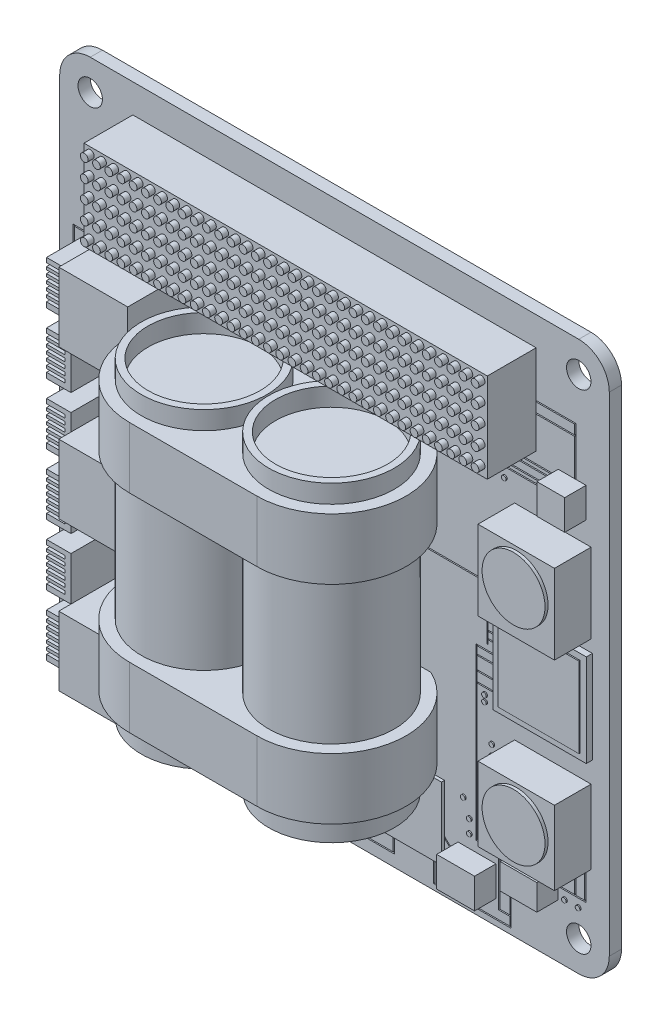
from build123d import *
from OCP.BRepFilletAPI import BRepFilletAPI_MakeChamfer

# Parameters (mm, degrees)
SKETCH1_W                     = 90
SKETCH1_H                     = 90
BOSS_EXTRUDE1_DEPTH           = 2
FILLET1_R                     = 5
SKETCH2_R                     = 2
CUT_EXTRUDE1_DEPTH            = 2
SKETCH3_W                     = 66.045919966
SKETCH3_H                     = 14.648074504
BOSS_EXTRUDE2_DEPTH           = 8
SKETCH4_R                     = 0.63201174
BOSS_EXTRUDE3_DEPTH           = 1
BOSS_EXTRUDE4_START           = 3
SKETCH5_R                     = 10.297013514
BOSS_EXTRUDE4_DEPTH           = 51
BOSS_EXTRUDE4_2_DEPTH         = 51
SKETCH6_R                     = 9.178141341
CUT_EXTRUDE2_DEPTH            = 3
SKETCH7_R                     = 9.178141341
CUT_EXTRUDE3_DEPTH            = 3
BOSS_EXTRUDE5_START           = -1
BOSS_EXTRUDE5_DEPTH           = 10
LPATTERN1_COUNT               = 2
LPATTERN1_PITCH               = 34
SKETCH9_W                     = 11.294906271
SKETCH9_H                     = 11.294906271
SKETCH9_H_2                   = 11.29490627
BOSS_EXTRUDE6_DEPTH           = 10
SKETCH10_W                    = 4.004248946
SKETCH10_H                    = 7.175245947
BOSS_EXTRUDE7_DEPTH           = 8
SKETCH11_W                    = 2.034326561
SKETCH11_H                    = 0.53377272
CUT_EXTRUDE4_DEPTH            = 3
LPATTERN2_COUNT               = 6
LPATTERN2_PITCH               = 10
SKETCH12_W                    = 12.521625327
SKETCH12_H                    = 12.116411975
SKETCH12_H_2                  = 13.021482362
BOSS_EXTRUDE8_DEPTH           = 6
SKETCH13_R                    = 5.151930766
BOSS_EXTRUDE9_DEPTH           = 0.5
SKETCH14_W                    = 15.282265806
SKETCH14_H                    = 15.130956244
BOSS_EXTRUDE10_DEPTH          = 1
SKETCH15_W                    = 14.979646681
SKETCH15_H                    = 11.80214587
BOSS_EXTRUDE11_DEPTH          = 0.5
SKETCH16_R                    = 6.652439648
BOSS_EXTRUDE12_DEPTH          = 0.5
SKETCH17_W                    = 9.485581338
SKETCH17_H                    = 1.963853578
SKETCH17_W_2                  = 7.713549659
BOSS_EXTRUDE13_DEPTH          = 10.5
CHAMFER1_SIZE                 = 10
CHAMFER1_SIZE2                = 1.227845609
SKETCH18_W                    = 4.557516941
SKETCH18_H                    = 4.922118296
SKETCH18_W_2                  = 6.015922362
SKETCH18_H_2                  = 4.192915586
SKETCH18_W_3                  = 6.198223039
SKETCH18_H_3                  = 4.010614908
SKETCH18_H_4                  = 3.646013552
BOSS_EXTRUDE14_DEPTH          = 3.5
CUT_EXTRUDE_THIN3_START       = -0.2
CUT_EXTRUDE_THIN3_OUTLINE_W   = 0.2
CUT_EXTRUDE_THIN3_OUTLINE_H   = 67.261210644
CUT_EXTRUDE_THIN3_OUTLINE_W_2 = 9.692781781
CUT_EXTRUDE_THIN3_OUTLINE_H_2 = 0.2
CUT_EXTRUDE_THIN3_OUTLINE_W_3 = 8.725884702
CUT_EXTRUDE_THIN3_OUTLINE_W_4 = 7.231547932
CUT_EXTRUDE_THIN3_OUTLINE_H_3 = 3.995497833
CUT_EXTRUDE_THIN3_DEPTH       = 0.2
SKETCH20_R                    = 0.38040715
BOSS_EXTRUDE15_DEPTH          = 0.2
SKETCH21_W                    = 13.282265806
SKETCH21_H                    = 13.130956244
BOSS_EXTRUDE16_DEPTH          = 0.2


# Read off the part's stored shape, not the designer's step: Cut-Extrude-Thin3
with BuildPart() as part:
    # Sketch1 → Boss-Extrude1 (new body)
    with BuildSketch(Plane.XY):
        Rectangle(SKETCH1_W, SKETCH1_H)
    extrude(amount=BOSS_EXTRUDE1_DEPTH)

    # Fillet1
    fillet1_edges = [part.edges().sort_by_distance(p)[0] for p in [
        (45, -45, 1),
        (-45, -45, 1),
        (-45, 45, 1),
        (45, 45, 1),
    ]]
    fillet(fillet1_edges, radius=FILLET1_R)

    # Sketch2 → Cut-Extrude1 (cut)
    with BuildSketch(Plane.XY.offset(2)):
        with Locations((-40, 40)):
            Circle(SKETCH2_R)
        with Locations((40, 40)):
            Circle(SKETCH2_R)
        with Locations((40, -40)):
            Circle(SKETCH2_R)
        with Locations((-40, -40)):
            Circle(SKETCH2_R)
    extrude(amount=-CUT_EXTRUDE1_DEPTH, mode=Mode.SUBTRACT)

    # Sketch3 → Boss-Extrude2 (add)
    with BuildSketch(Plane.XY.offset(2)):
        with Locations((0, 32.977358243)):
            Rectangle(SKETCH3_W, SKETCH3_H)
    extrude(amount=BOSS_EXTRUDE2_DEPTH)

    # Sketch4 → Boss-Extrude3 (add)
    with BuildSketch(Plane.XY.offset(10)):
        with Locations((-31.982231019, 39.260666531)):
            Circle(SKETCH4_R)
        with Locations((-29.982231019, 39.260666531)):
            Circle(SKETCH4_R)
        with Locations((-27.982231019, 39.260666531)):
            Circle(SKETCH4_R)
        with Locations((-25.982231019, 39.260666531)):
            Circle(SKETCH4_R)
        with Locations((-23.982231019, 39.260666531)):
            Circle(SKETCH4_R)
        with Locations((-21.982231019, 39.260666531)):
            Circle(SKETCH4_R)
        with Locations((-19.982231019, 39.260666531)):
            Circle(SKETCH4_R)
        with Locations((-17.982231019, 39.260666531)):
            Circle(SKETCH4_R)
        with Locations((-15.982231019, 39.260666531)):
            Circle(SKETCH4_R)
        with Locations((-13.982231019, 39.260666531)):
            Circle(SKETCH4_R)
        with Locations((-11.982231019, 39.260666531)):
            Circle(SKETCH4_R)
        with Locations((-9.982231019, 39.260666531)):
            Circle(SKETCH4_R)
        with Locations((-7.982231019, 39.260666531)):
            Circle(SKETCH4_R)
        with Locations((-5.982231019, 39.260666531)):
            Circle(SKETCH4_R)
        with Locations((-3.982231019, 39.260666531)):
            Circle(SKETCH4_R)
        with Locations((-1.982231019, 39.260666531)):
            Circle(SKETCH4_R)
        with Locations((0.017768981, 39.260666531)):
            Circle(SKETCH4_R)
        with Locations((2.017768981, 39.260666531)):
            Circle(SKETCH4_R)
        with Locations((4.017768981, 39.260666531)):
            Circle(SKETCH4_R)
        with Locations((6.017768981, 39.260666531)):
            Circle(SKETCH4_R)
        with Locations((8.017768981, 39.260666531)):
            Circle(SKETCH4_R)
        with Locations((10.017768981, 39.260666531)):
            Circle(SKETCH4_R)
        with Locations((12.017768981, 39.260666531)):
            Circle(SKETCH4_R)
        with Locations((14.017768981, 39.260666531)):
            Circle(SKETCH4_R)
        with Locations((16.017768981, 39.260666531)):
            Circle(SKETCH4_R)
        with Locations((18.017768981, 39.260666531)):
            Circle(SKETCH4_R)
        with Locations((20.017768981, 39.260666531)):
            Circle(SKETCH4_R)
        with Locations((22.017768981, 39.260666531)):
            Circle(SKETCH4_R)
        with Locations((24.017768981, 39.260666531)):
            Circle(SKETCH4_R)
        with Locations((26.017768981, 39.260666531)):
            Circle(SKETCH4_R)
        with Locations((28.017768981, 39.260666531)):
            Circle(SKETCH4_R)
        with Locations((30.017768981, 39.260666531)):
            Circle(SKETCH4_R)
        with Locations((32.017768981, 39.260666531)):
            Circle(SKETCH4_R)
        with Locations((-29.982231019, 36.260666531)):
            Circle(SKETCH4_R)
        with Locations((-27.982231019, 36.260666531)):
            Circle(SKETCH4_R)
        with Locations((-25.982231019, 36.260666531)):
            Circle(SKETCH4_R)
        with Locations((-23.982231019, 36.260666531)):
            Circle(SKETCH4_R)
        with Locations((-21.982231019, 36.260666531)):
            Circle(SKETCH4_R)
        with Locations((-19.982231019, 36.260666531)):
            Circle(SKETCH4_R)
        with Locations((-17.982231019, 36.260666531)):
            Circle(SKETCH4_R)
        with Locations((-15.982231019, 36.260666531)):
            Circle(SKETCH4_R)
        with Locations((-13.982231019, 36.260666531)):
            Circle(SKETCH4_R)
        with Locations((-11.982231019, 36.260666531)):
            Circle(SKETCH4_R)
        with Locations((-9.982231019, 36.260666531)):
            Circle(SKETCH4_R)
        with Locations((-7.982231019, 36.260666531)):
            Circle(SKETCH4_R)
        with Locations((-5.982231019, 36.260666531)):
            Circle(SKETCH4_R)
        with Locations((-3.982231019, 36.260666531)):
            Circle(SKETCH4_R)
        with Locations((-1.982231019, 36.260666531)):
            Circle(SKETCH4_R)
        with Locations((0.017768981, 36.260666531)):
            Circle(SKETCH4_R)
        with Locations((2.017768981, 36.260666531)):
            Circle(SKETCH4_R)
        with Locations((4.017768981, 36.260666531)):
            Circle(SKETCH4_R)
        with Locations((6.017768981, 36.260666531)):
            Circle(SKETCH4_R)
        with Locations((8.017768981, 36.260666531)):
            Circle(SKETCH4_R)
        with Locations((10.017768981, 36.260666531)):
            Circle(SKETCH4_R)
        with Locations((12.017768981, 36.260666531)):
            Circle(SKETCH4_R)
        with Locations((14.017768981, 36.260666531)):
            Circle(SKETCH4_R)
        with Locations((16.017768981, 36.260666531)):
            Circle(SKETCH4_R)
        with Locations((18.017768981, 36.260666531)):
            Circle(SKETCH4_R)
        with Locations((20.017768981, 36.260666531)):
            Circle(SKETCH4_R)
        with Locations((22.017768981, 36.260666531)):
            Circle(SKETCH4_R)
        with Locations((24.017768981, 36.260666531)):
            Circle(SKETCH4_R)
        with Locations((26.017768981, 36.260666531)):
            Circle(SKETCH4_R)
        with Locations((28.017768981, 36.260666531)):
            Circle(SKETCH4_R)
        with Locations((30.017768981, 36.260666531)):
            Circle(SKETCH4_R)
        with Locations((32.017768981, 36.260666531)):
            Circle(SKETCH4_R)
        with Locations((-29.982231019, 33.260666531)):
            Circle(SKETCH4_R)
        with Locations((-27.982231019, 33.260666531)):
            Circle(SKETCH4_R)
        with Locations((-25.982231019, 33.260666531)):
            Circle(SKETCH4_R)
        with Locations((-23.982231019, 33.260666531)):
            Circle(SKETCH4_R)
        with Locations((-21.982231019, 33.260666531)):
            Circle(SKETCH4_R)
        with Locations((-19.982231019, 33.260666531)):
            Circle(SKETCH4_R)
        with Locations((-17.982231019, 33.260666531)):
            Circle(SKETCH4_R)
        with Locations((-15.982231019, 33.260666531)):
            Circle(SKETCH4_R)
        with Locations((-13.982231019, 33.260666531)):
            Circle(SKETCH4_R)
        with Locations((-11.982231019, 33.260666531)):
            Circle(SKETCH4_R)
        with Locations((-9.982231019, 33.260666531)):
            Circle(SKETCH4_R)
        with Locations((-7.982231019, 33.260666531)):
            Circle(SKETCH4_R)
        with Locations((-5.982231019, 33.260666531)):
            Circle(SKETCH4_R)
        with Locations((-3.982231019, 33.260666531)):
            Circle(SKETCH4_R)
        with Locations((-1.982231019, 33.260666531)):
            Circle(SKETCH4_R)
        with Locations((0.017768981, 33.260666531)):
            Circle(SKETCH4_R)
        with Locations((2.017768981, 33.260666531)):
            Circle(SKETCH4_R)
        with Locations((4.017768981, 33.260666531)):
            Circle(SKETCH4_R)
        with Locations((6.017768981, 33.260666531)):
            Circle(SKETCH4_R)
        with Locations((8.017768981, 33.260666531)):
            Circle(SKETCH4_R)
        with Locations((10.017768981, 33.260666531)):
            Circle(SKETCH4_R)
        with Locations((12.017768981, 33.260666531)):
            Circle(SKETCH4_R)
        with Locations((14.017768981, 33.260666531)):
            Circle(SKETCH4_R)
        with Locations((16.017768981, 33.260666531)):
            Circle(SKETCH4_R)
        with Locations((18.017768981, 33.260666531)):
            Circle(SKETCH4_R)
        with Locations((20.017768981, 33.260666531)):
            Circle(SKETCH4_R)
        with Locations((22.017768981, 33.260666531)):
            Circle(SKETCH4_R)
        with Locations((24.017768981, 33.260666531)):
            Circle(SKETCH4_R)
        with Locations((26.017768981, 33.260666531)):
            Circle(SKETCH4_R)
        with Locations((28.017768981, 33.260666531)):
            Circle(SKETCH4_R)
        with Locations((30.017768981, 33.260666531)):
            Circle(SKETCH4_R)
        with Locations((32.017768981, 33.260666531)):
            Circle(SKETCH4_R)
        with Locations((-29.982231019, 30.260666531)):
            Circle(SKETCH4_R)
        with Locations((-27.982231019, 30.260666531)):
            Circle(SKETCH4_R)
        with Locations((-25.982231019, 30.260666531)):
            Circle(SKETCH4_R)
        with Locations((-23.982231019, 30.260666531)):
            Circle(SKETCH4_R)
        with Locations((-21.982231019, 30.260666531)):
            Circle(SKETCH4_R)
        with Locations((-19.982231019, 30.260666531)):
            Circle(SKETCH4_R)
        with Locations((-17.982231019, 30.260666531)):
            Circle(SKETCH4_R)
        with Locations((-15.982231019, 30.260666531)):
            Circle(SKETCH4_R)
        with Locations((-13.982231019, 30.260666531)):
            Circle(SKETCH4_R)
        with Locations((-11.982231019, 30.260666531)):
            Circle(SKETCH4_R)
        with Locations((-9.982231019, 30.260666531)):
            Circle(SKETCH4_R)
        with Locations((-7.982231019, 30.260666531)):
            Circle(SKETCH4_R)
        with Locations((-5.982231019, 30.260666531)):
            Circle(SKETCH4_R)
        with Locations((-3.982231019, 30.260666531)):
            Circle(SKETCH4_R)
        with Locations((-1.982231019, 30.260666531)):
            Circle(SKETCH4_R)
        with Locations((0.017768981, 30.260666531)):
            Circle(SKETCH4_R)
        with Locations((2.017768981, 30.260666531)):
            Circle(SKETCH4_R)
        with Locations((4.017768981, 30.260666531)):
            Circle(SKETCH4_R)
        with Locations((6.017768981, 30.260666531)):
            Circle(SKETCH4_R)
        with Locations((8.017768981, 30.260666531)):
            Circle(SKETCH4_R)
        with Locations((10.017768981, 30.260666531)):
            Circle(SKETCH4_R)
        with Locations((12.017768981, 30.260666531)):
            Circle(SKETCH4_R)
        with Locations((14.017768981, 30.260666531)):
            Circle(SKETCH4_R)
        with Locations((16.017768981, 30.260666531)):
            Circle(SKETCH4_R)
        with Locations((18.017768981, 30.260666531)):
            Circle(SKETCH4_R)
        with Locations((20.017768981, 30.260666531)):
            Circle(SKETCH4_R)
        with Locations((22.017768981, 30.260666531)):
            Circle(SKETCH4_R)
        with Locations((24.017768981, 30.260666531)):
            Circle(SKETCH4_R)
        with Locations((26.017768981, 30.260666531)):
            Circle(SKETCH4_R)
        with Locations((28.017768981, 30.260666531)):
            Circle(SKETCH4_R)
        with Locations((30.017768981, 30.260666531)):
            Circle(SKETCH4_R)
        with Locations((32.017768981, 30.260666531)):
            Circle(SKETCH4_R)
        with Locations((-29.982231019, 27.260666531)):
            Circle(SKETCH4_R)
        with Locations((-27.982231019, 27.260666531)):
            Circle(SKETCH4_R)
        with Locations((-25.982231019, 27.260666531)):
            Circle(SKETCH4_R)
        with Locations((-23.982231019, 27.260666531)):
            Circle(SKETCH4_R)
        with Locations((-21.982231019, 27.260666531)):
            Circle(SKETCH4_R)
        with Locations((-19.982231019, 27.260666531)):
            Circle(SKETCH4_R)
        with Locations((-17.982231019, 27.260666531)):
            Circle(SKETCH4_R)
        with Locations((-15.982231019, 27.260666531)):
            Circle(SKETCH4_R)
        with Locations((-13.982231019, 27.260666531)):
            Circle(SKETCH4_R)
        with Locations((-11.982231019, 27.260666531)):
            Circle(SKETCH4_R)
        with Locations((-9.982231019, 27.260666531)):
            Circle(SKETCH4_R)
        with Locations((-7.982231019, 27.260666531)):
            Circle(SKETCH4_R)
        with Locations((-5.982231019, 27.260666531)):
            Circle(SKETCH4_R)
        with Locations((-3.982231019, 27.260666531)):
            Circle(SKETCH4_R)
        with Locations((-1.982231019, 27.260666531)):
            Circle(SKETCH4_R)
        with Locations((0.017768981, 27.260666531)):
            Circle(SKETCH4_R)
        with Locations((2.017768981, 27.260666531)):
            Circle(SKETCH4_R)
        with Locations((4.017768981, 27.260666531)):
            Circle(SKETCH4_R)
        with Locations((6.017768981, 27.260666531)):
            Circle(SKETCH4_R)
        with Locations((8.017768981, 27.260666531)):
            Circle(SKETCH4_R)
        with Locations((10.017768981, 27.260666531)):
            Circle(SKETCH4_R)
        with Locations((12.017768981, 27.260666531)):
            Circle(SKETCH4_R)
        with Locations((14.017768981, 27.260666531)):
            Circle(SKETCH4_R)
        with Locations((16.017768981, 27.260666531)):
            Circle(SKETCH4_R)
        with Locations((18.017768981, 27.260666531)):
            Circle(SKETCH4_R)
        with Locations((20.017768981, 27.260666531)):
            Circle(SKETCH4_R)
        with Locations((22.017768981, 27.260666531)):
            Circle(SKETCH4_R)
        with Locations((24.017768981, 27.260666531)):
            Circle(SKETCH4_R)
        with Locations((26.017768981, 27.260666531)):
            Circle(SKETCH4_R)
        with Locations((28.017768981, 27.260666531)):
            Circle(SKETCH4_R)
        with Locations((30.017768981, 27.260666531)):
            Circle(SKETCH4_R)
        with Locations((32.017768981, 27.260666531)):
            Circle(SKETCH4_R)
        with Locations((-31.982231019, 36.260666531)):
            Circle(SKETCH4_R)
        with Locations((-31.982231019, 33.260666531)):
            Circle(SKETCH4_R)
        with Locations((-31.982231019, 30.260666531)):
            Circle(SKETCH4_R)
        with Locations((-31.982231019, 27.260666531)):
            Circle(SKETCH4_R)
    extrude(amount=BOSS_EXTRUDE3_DEPTH)



with BuildPart() as body_2:
    # Sketch5 → Boss-Extrude4 (new body)
    with BuildSketch(Plane(origin=(0, 25.653320991, 0), x_dir=(-1, 0, 0), z_dir=(0, -1, 0)).offset(BOSS_EXTRUDE4_START)):
        with Locations(Location((10.32271364, -13.024431403, 0), (0, 0, 90))):
            Circle(SKETCH5_R)
    extrude(amount=BOSS_EXTRUDE4_DEPTH)


with BuildPart() as body_3:
    # Sketch5 → Boss-Extrude4 2 (new body)
    with BuildSketch(Plane(origin=(0, 25.653320991, 0), x_dir=(-1, 0, 0), z_dir=(0, -1, 0)).offset(BOSS_EXTRUDE4_START)):
        with Locations(Location((-10.541843364, -13.024431403, 0), (0, 0, 90))):
            Circle(SKETCH5_R)
    extrude(amount=BOSS_EXTRUDE4_2_DEPTH)


with BuildPart() as cut_extrude2_tool:
    # Sketch6 → Cut-Extrude2 (new body)
    with BuildSketch(Plane(origin=(0, -28.346679009, 0), x_dir=(-1, 0, 0), z_dir=(0, -1, 0))):
        with Locations(Location((-10.541843364, -13.024431403, 0), (0, 0, 90))):
            Circle(SKETCH6_R)
        with Locations(Location((10.32271364, -13.024431403, 0), (0, 0, 90))):
            Circle(SKETCH6_R)
    extrude(amount=-CUT_EXTRUDE2_DEPTH)


with BuildPart() as body_2_1:
    add(body_2.part)

    # Cut-Extrude2: cut by cut_extrude2_tool
    add(cut_extrude2_tool.part, mode=Mode.SUBTRACT)


with BuildPart() as body_3_1:
    add(body_3.part)

    # Cut-Extrude2: cut by cut_extrude2_tool
    add(cut_extrude2_tool.part, mode=Mode.SUBTRACT)


with BuildPart() as cut_extrude3_tool:
    # Sketch7 → Cut-Extrude3 (new body)
    with BuildSketch(Plane(origin=(0, 22.653320991, 0), x_dir=(1, 0, 0), z_dir=(0, 1, 0))):
        with Locations(Location((-10.32271364, -13.024431403, 0), (0, 0, 90))):
            Circle(SKETCH7_R)
        with Locations(Location((10.541843364, -13.024431403, 0), (0, 0, 90))):
            Circle(SKETCH7_R)
    extrude(amount=-CUT_EXTRUDE3_DEPTH)


with BuildPart() as body_2_2:
    add(body_2_1.part)

    # Cut-Extrude3: cut by cut_extrude3_tool
    add(cut_extrude3_tool.part, mode=Mode.SUBTRACT)


with BuildPart() as body_3_2:
    add(body_3_1.part)

    # Cut-Extrude3: cut by cut_extrude3_tool
    add(cut_extrude3_tool.part, mode=Mode.SUBTRACT)


with BuildPart() as part_1:
    add(part.part)

    add(body_2_2.part)  # Boss-Extrude5 merges body 2

    add(body_3_2.part)  # Boss-Extrude5 merges body 3
    # Sketch8 → Boss-Extrude5 (add)
    with BuildSketch(Plane.XZ.offset(25.346679009).offset(BOSS_EXTRUDE5_START)):
        with BuildLine():
            Line((-10.32271364, 25.243494506), (10.541843364, 25.243494506))
            ThreePointArc((10.541843364, 25.243494506), (22.417980671, 10.149911312), (4.954148953, 2.15782318))
            Line((4.954148953, 2.15782318), (-15.910408051, 2.15782318))
            ThreePointArc((-15.910408051, 2.15782318), (-22.198850948, 15.898951495), (-10.32271364, 25.243494506))
        make_face()
    boss_extrude5 = extrude(amount=-BOSS_EXTRUDE5_DEPTH)

    # LPattern1: Boss-Extrude5 ×2
    with Locations(*[(0, i * LPATTERN1_PITCH, 0) for i in range(1, LPATTERN1_COUNT)]):
        add(boss_extrude5)

    # Sketch9 → Boss-Extrude6 (add)
    with BuildSketch(Plane.XY.offset(2)):
        with Locations((-29.507466228, -31.783897831)):
            Rectangle(SKETCH9_W, SKETCH9_H)
        with Locations((-29.507466228, -7.389014988)):
            Rectangle(SKETCH9_W, SKETCH9_H_2)
        with Locations((-29.507466228, 17.005867856)):
            Rectangle(SKETCH9_W, SKETCH9_H)
    extrude(amount=BOSS_EXTRUDE6_DEPTH)

    # Sketch10 → Boss-Extrude7 (add)
    with BuildSketch(Plane.XY.offset(2)):
        with Locations((-37.157043836, -32.560031338)):
            Rectangle(SKETCH10_W, SKETCH10_H)
    boss_extrude7 = extrude(amount=BOSS_EXTRUDE7_DEPTH)

    # Sketch11 → Cut-Extrude4 (cut)
    with BuildSketch(Plane.ZY.offset(39.159168309)):
        with Locations((8.982836719, -35.003054613)):
            Rectangle(SKETCH11_W, SKETCH11_H)
        with Locations((8.982836719, -34.003054613)):
            Rectangle(SKETCH11_W, SKETCH11_H)
        with Locations((8.982836719, -33.003054613)):
            Rectangle(SKETCH11_W, SKETCH11_H)
        with Locations((8.982836719, -32.003054613)):
            Rectangle(SKETCH11_W, SKETCH11_H)
        with Locations((8.982836719, -31.003054613)):
            Rectangle(SKETCH11_W, SKETCH11_H)
        with Locations((8.982836719, -30.003054613)):
            Rectangle(SKETCH11_W, SKETCH11_H)
    cut_extrude4 = extrude(amount=-CUT_EXTRUDE4_DEPTH, mode=Mode.SUBTRACT)

    # LPattern2: Boss-Extrude7, Cut-Extrude4 ×6
    with Locations(*[(0, i * LPATTERN2_PITCH, 0) for i in range(1, LPATTERN2_COUNT)]):
        add(boss_extrude7)
        add(cut_extrude4, mode=Mode.SUBTRACT)

    # Sketch12 → Boss-Extrude8 (add)
    with BuildSketch(Plane.XY.offset(2)):
        with Locations((35.759925831, -23.140315104)):
            Rectangle(SKETCH12_W, SKETCH12_H)
        with Locations((35.759925831, 10.013112467)):
            Rectangle(SKETCH12_W, SKETCH12_H_2)
    extrude(amount=BOSS_EXTRUDE8_DEPTH)

    # Sketch13 → Boss-Extrude9 (add)
    with BuildSketch(Plane.XY.offset(8)):
        with Locations((35.821614554, -22.817889805)):
            Circle(SKETCH13_R)
        with Locations((35.821614554, 10.785385374)):
            Circle(SKETCH13_R)
    extrude(amount=BOSS_EXTRUDE9_DEPTH)

    # Sketch14 → Boss-Extrude10 (add)
    with BuildSketch(Plane.XY.offset(2)):
        with Locations((34.589821725, -6.001201582)):
            Rectangle(SKETCH14_W, SKETCH14_H)
    extrude(amount=BOSS_EXTRUDE10_DEPTH)

    # Sketch15 → Boss-Extrude11 (add)
    with BuildSketch(Plane.XY.offset(2)):
        with Locations((-9.13864182, -34.447399321)):
            Rectangle(SKETCH15_W, SKETCH15_H)
        with Locations((10.531601298, -34.447399321)):
            Rectangle(SKETCH15_W, SKETCH15_H)
    extrude(amount=BOSS_EXTRUDE11_DEPTH)

    # Sketch16 → Boss-Extrude12 (add)
    with BuildSketch(Plane(origin=(0, -25.346679009, 0), x_dir=(-1, 0, 0), z_dir=(0, -1, 0))):
        with Locations(Location((10.32271364, -13.024431403, 0), (0, 0, 90))):
            Circle(SKETCH16_R)
        with Locations(Location((-10.541843364, -13.024431403, 0), (0, 0, 90))):
            Circle(SKETCH16_R)
    extrude(amount=BOSS_EXTRUDE12_DEPTH)

    # Sketch17 → Boss-Extrude13 (add)
    with BuildSketch(Plane.XY.offset(2.5)):
        with Locations((-9.065287299, -29.528253175)):
            Rectangle(SKETCH17_W, SKETCH17_H)
        with Locations((10.374942587, -29.528253175)):
            Rectangle(SKETCH17_W_2, SKETCH17_H)
    extrude(amount=BOSS_EXTRUDE13_DEPTH)

    # Chamfer1: one chamfer whose edges measure the first distance from different faces: ONE call of the kernel's chamfer builder (chamfer() names one face for all edges)
    chamfer1_edges_1 = [part_1.edges().sort_by_distance(p)[0] for p in [
        (-9.065287299, -30.510179964, 13),
    ]]
    chamfer1_side_1 = [part_1.faces().sort_by_distance(p)[0] for p in [
        (-9.065287299, -30.510179964, 7.75),
    ]]
    chamfer1_edges_2 = [part_1.edges().sort_by_distance(p)[0] for p in [
        (10.374942586, -30.510179964, 13),
    ]]
    chamfer1_side_2 = [part_1.faces().sort_by_distance(p)[0] for p in [
        (10.374942586, -30.510179964, 7.75),
    ]]
    chamfer1 = BRepFilletAPI_MakeChamfer(part_1.part.solid().wrapped)
    for e in chamfer1_edges_1:
        chamfer1.Add(CHAMFER1_SIZE, CHAMFER1_SIZE2, e.wrapped, chamfer1_side_1[0].wrapped)  # the first distance lies on this face
    for e in chamfer1_edges_2:
        chamfer1.Add(CHAMFER1_SIZE, CHAMFER1_SIZE2, e.wrapped, chamfer1_side_2[0].wrapped)  # the first distance lies on this face
    add(Compound.cast(chamfer1.Shape()), mode=Mode.REPLACE)

    # Sketch18 → Boss-Extrude14 (add)
    with BuildSketch(Plane.XY.offset(2)):
        with Locations((38.921194676, 22.422983349)):
            Rectangle(SKETCH18_W, SKETCH18_H)
        with Locations((33.634475024, -34.090226718)):
            Rectangle(SKETCH18_W_2, SKETCH18_H_2)
        with Locations((23.334486738, -38.647743659)):
            Rectangle(SKETCH18_W_3, SKETCH18_H)
        with Locations((-29.623860116, 8.112380155)):
            Rectangle(SKETCH18_W, SKETCH18_H_3)
        with Locations((-29.623860116, -17.045113359)):
            Rectangle(SKETCH18_W, SKETCH18_H_4)
    extrude(amount=BOSS_EXTRUDE14_DEPTH)

    # Cut-Extrude-Thin3 outline → Cut-Extrude-Thin3 (cut)
    with BuildSketch(Plane.XY.offset(2).offset(CUT_EXTRUDE_THIN3_START)):
        with Locations((-33.122959983, -7.977284331)):
            Rectangle(CUT_EXTRUDE_THIN3_OUTLINE_W, CUT_EXTRUDE_THIN3_OUTLINE_H)
        with Locations((32.762942393, 23.740622677)):
            Rectangle(CUT_EXTRUDE_THIN3_OUTLINE_W_2, CUT_EXTRUDE_THIN3_OUTLINE_H_2)
        with Locations((32.762942393, 23.02693009)):
            Rectangle(CUT_EXTRUDE_THIN3_OUTLINE_W_2, CUT_EXTRUDE_THIN3_OUTLINE_H_2)
        with Locations((32.279493854, 21.670914176)):
            Rectangle(CUT_EXTRUDE_THIN3_OUTLINE_W_3, CUT_EXTRUDE_THIN3_OUTLINE_H_2)
        Polygon((26.948688822, 26.352654505), (26.948688822, 20.85722159), (37.609333284, 20.85722159), (37.609333284, 21.05722159), (27.148688822, 21.05722159), (27.148688822, 26.352654505), align=None)
        Polygon((-36.159168309, -34.469940973), (-36.159168309, -34.269940973), (-42.598664083, -34.269940973), (-42.598664083, -23.936168253), (-37.659168309, -23.936168253), (-37.659168309, -23.736168253), (-42.598664083, -23.736168253), (-42.598664083, -12.936168253), (-36.638533094, -12.936168253), (-36.638533094, -12.736168253), (-42.598664083, -12.736168253), (-42.598664083, -2.850884053), (-37.662622156, -2.936138428), (-37.659168309, -2.736168253), (-42.598664083, -2.650854224), (-42.598664083, 7.588684014), (-37.661542436, 7.530073119), (-37.659168309, 7.730059027), (-42.598664083, 7.788698107), (-42.598664083, 16.261935113), (-37.667189569, 16.063992663), (-37.659168309, 16.263831747), (-42.598664083, 16.462096159), (-42.598664083, 19.730059027), (-39.159168309, 19.730059027), (-39.159168309, 19.930059027), (-42.798664083, 19.930059027), (-42.798664083, -34.469940973), align=None)
        Polygon((1.660010001, -34.447399321), (-1.648818479, -34.447399321), (-1.648818479, -34.647399321), (1.860010001, -34.647399321), (1.860010001, -30.940340571), (1.660010001, -30.940340571), align=None)
        Polygon((25.153497992, -5.044357383), (28.728943811, -5.044357383), (28.728943811, -4.844357383), (25.153497992, -4.844357383), (25.153497992, -3.860506173), (29.912091769, -3.860506173), (29.912091769, -3.660506173), (25.153497992, -3.660506173), (25.153497992, -1.640785154), (28.728943811, -1.640785154), (28.728943811, -1.440785154), (25.153497992, -1.440785154), (25.153497992, -0.2), (27.916551503, -0.2), (27.916551503, 0), (25.153497992, 0), (25.153497992, 11.423084132), (29.499113168, 11.423084132), (29.499113168, 11.623084132), (24.953497992, 11.623084132), (24.953497992, 3.153112724), (9.820726728, 3.153112724), (9.820726728, 2.953112724), (24.953497992, 2.953112724), (24.953497992, -5.716858684), (25.153497992, -5.716858684), align=None)
        Polygon((39.317518055, -27.984646636), (39.317518055, -34.090226718), (36.642436205, -34.090226718), (36.642436205, -34.290226718), (41.177350395, -34.290226718), (41.177350395, -28.012531893), (40.977350395, -28.012531893), (40.977350395, -34.090226718), (39.517518055, -34.090226718), (39.517518055, -27.984646636), align=None)
        Polygon((16.421936883, -40.348472256), (16.221936883, -40.348472256), (16.221936883, -44.079785876), (28.928943811, -44.079785876), (28.928943811, -34.647399321), (30.626513843, -34.647399321), (30.626513843, -34.447399321), (28.728943811, -34.447399321), (28.728943811, -42.287921492), (27.073124632, -42.287921492), (27.073124632, -31.140340571), (33.011746006, -31.140340571), (33.011746006, -29.198521091), (32.811746006, -29.198521091), (32.811746006, -30.940340571), (26.873124632, -30.940340571), (26.873124632, -34.247399321), (23.372483893, -34.247399321), (23.372483893, -24.943077496), (29.499113168, -24.943077496), (29.499113168, -24.743077496), (23.372483893, -24.743077496), (23.372483893, -12.073473941), (27.916551503, -12.073473941), (27.916551503, -11.873473941), (23.372483893, -11.873473941), (23.372483893, -10.371687827), (26.948688822, -10.371687827), (26.948688822, -10.171687827), (23.372483893, -10.171687827), (23.372483893, -8.151966809), (27.937278111, -8.151966809), (27.937278111, -7.951966809), (23.372483893, -7.951966809), (23.372483893, -6.789617572), (29.912091769, -6.789617572), (29.912091769, -6.589617572), (23.172483893, -6.589617572), (23.172483893, -34.447399321), (26.873124632, -34.447399321), (26.873124632, -42.487921492), (28.728943811, -42.487921492), (28.728943811, -43.879785876), (16.421936883, -43.879785876), align=None)
        with Locations((-20.244239126, -36.591474898)):
            Rectangle(CUT_EXTRUDE_THIN3_OUTLINE_W_4, CUT_EXTRUDE_THIN3_OUTLINE_H_2)
        Polygon((-13.321942824, -41.607889653), (-13.321942824, -40.348472256), (-13.521942824, -40.348472256), (-13.521942824, -43.099510029), (9.820726728, -43.099510029), (9.820726728, -40.348472256), (9.620726728, -40.348472256), (9.620726728, -42.899510029), (-13.321942824, -42.899510029), (-13.321942824, -41.807889653), (3.899240702, -41.807889653), (3.899240702, -41.607889653), align=None)
        Polygon((1.660010001, -36.491474898), (-1.648818479, -36.491474898), (-1.648818479, -36.691474898), (1.460010001, -36.691474898), (1.460010001, -40.348472256), (1.660010001, -40.348472256), align=None)
        with Locations((-20.244239126, -33.483249086)):
            Rectangle(CUT_EXTRUDE_THIN3_OUTLINE_W_4, CUT_EXTRUDE_THIN3_OUTLINE_H_2)
        with Locations((36.742436205, 3.072647584)):
            Rectangle(CUT_EXTRUDE_THIN3_OUTLINE_W, CUT_EXTRUDE_THIN3_OUTLINE_H_3)
        Polygon((-29.658565842, -41.807889653), (-27.734259027, -41.807889653), (-27.734259027, 24.880157469), (-27.934259027, 24.880157469), (-27.934259027, -41.607889653), (-29.458565842, -41.607889653), (-29.458565842, 24.880157469), (-30.888947353, 24.880157469), (-30.888947353, -41.607889653), (-30.688947353, -41.607889653), (-30.688947353, 24.680157469), (-29.658565842, 24.680157469), align=None)
        Polygon((18.021424638, -36.491474898), (17.881882034, -36.634750373), (20.095832613, -38.791019133), (20.235375218, -38.647743659), align=None)
        Polygon((39.317518055, 30.892678271), (39.317518055, 24.384559651), (39.517518055, 24.384559651), (39.517518055, 32.828654792), (28.017768981, 32.828654792), (28.017768981, 32.628654792), (39.317518055, 32.628654792), (39.317518055, 31.092678271), (32.017768981, 31.092678271), (32.017768981, 30.892678271), align=None)
        with Locations((37.709333284, 3.072647584)):
            Rectangle(CUT_EXTRUDE_THIN3_OUTLINE_W, CUT_EXTRUDE_THIN3_OUTLINE_H_3)
    extrude(amount=CUT_EXTRUDE_THIN3_DEPTH, mode=Mode.SUBTRACT)

    # Sketch20 → Boss-Extrude15 (add)
    with BuildSketch(Plane.XY.offset(2)):
        with Locations(Location((-24.522078598, -40.631676254, 0), (0, 0, 180))):
            Circle(SKETCH20_R)
        with Locations(Location((-22.477416372, -40.631676254, 0), (0, 0, 180))):
            Circle(SKETCH20_R)
        with Locations(Location((-19.713033042, -40.631676254, 0), (0, 0, 180))):
            Circle(SKETCH20_R)
        with Locations(Location((-26.069154095, -16.924139465, 0), (0, 0, 180))):
            Circle(SKETCH20_R)
        with Locations(Location((-25.79713606, 8.240847823, 0), (0, 0, 180))):
            Circle(SKETCH20_R)
        with Locations(Location((25.854681915, -21.14662497, 0), (0, 0, 180))):
            Circle(SKETCH20_R)
        with Locations(Location((25.854681915, -19.479766681, 0), (0, 0, 180))):
            Circle(SKETCH20_R)
        with Locations(Location((24.670335237, -13.036468123, 0), (0, 0, 180))):
            Circle(SKETCH20_R)
        with Locations(Location((24.670335237, -14.040544898, 0), (0, 0, 180))):
            Circle(SKETCH20_R)
        with Locations(Location((37.744855673, -35.594093685, 0), (0, 0, 180))):
            Circle(SKETCH20_R)
        with Locations(Location((40, -35.594093685, 0), (0, 0, 180))):
            Circle(SKETCH20_R)
        with Locations(Location((22.183785799, -34.004962874, 0), (0, 0, 180))):
            Circle(SKETCH20_R)
        with Locations(Location((22.183785799, -31.85645879, 0), (0, 0, 180))):
            Circle(SKETCH20_R)
        with Locations(Location((21.184481574, -29.308233016, 0), (0, 0, 180))):
            Circle(SKETCH20_R)
        with Locations(Location((25.854681915, 19.354881574, 0), (0, 0, 180))):
            Circle(SKETCH20_R)
        with Locations(Location((27.916551503, 19.354881574, 0), (0, 0, 180))):
            Circle(SKETCH20_R)
    extrude(amount=BOSS_EXTRUDE15_DEPTH)

    # Sketch21 → Boss-Extrude16 (add)
    with BuildSketch(Plane.XY.offset(3)):
        with Locations((34.589821725, -6.001201582)):
            Rectangle(SKETCH21_W, SKETCH21_H)
    extrude(amount=BOSS_EXTRUDE16_DEPTH)


solid = part_1.part
